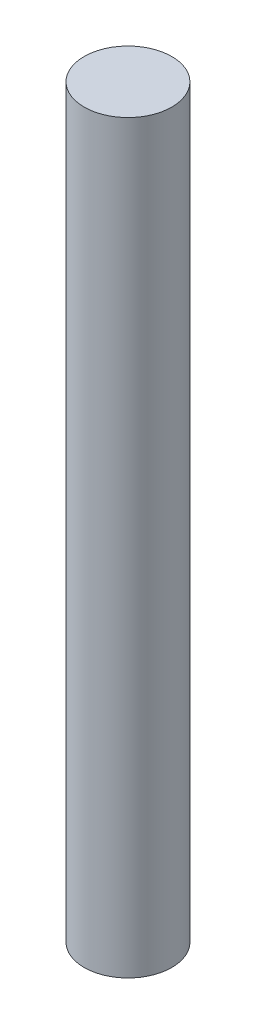
from build123d import *

# Parameters (mm, degrees)
SKETCH1_R           = 5
BOSS_EXTRUDE1_DEPTH = 85


with BuildPart() as part:
    # Sketch1 → Boss-Extrude1 (new body)
    with BuildSketch(Plane(origin=(0, 0, 0), x_dir=(1, 0, 0), z_dir=(0, 1, 0))):
        Circle(SKETCH1_R)
    extrude(amount=BOSS_EXTRUDE1_DEPTH)


solid = part.part
